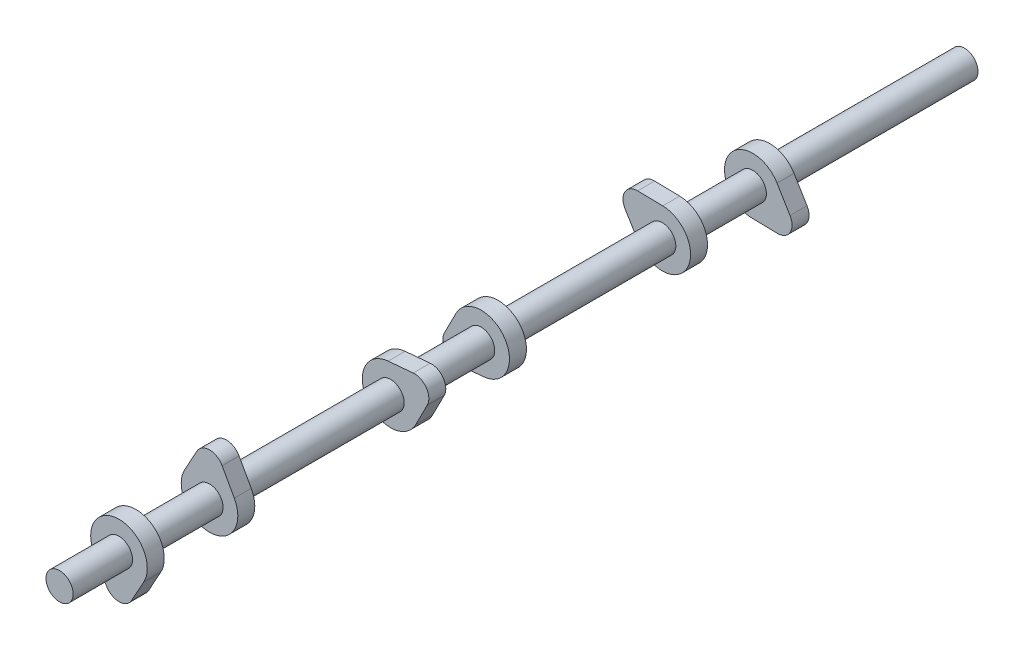
from build123d import *

# Parameters (mm, degrees)
SALIENTE_EXTRUIR1_DEPTH      = 3.75
S_LIDO_MOVER_COPIAR2_ANGLE   = 180
S_LIDO_MOVER_COPIAR4_START   = -243.75
S_LIDO_MOVER_COPIAR4_DEPTH   = 7.5
S_LIDO_MOVER_COPIAR4_START_2 = -203.75
S_LIDO_MOVER_COPIAR4_2_DEPTH = 7.5
S_LIDO_MOVER_COPIAR4_START_3 = -123.75
S_LIDO_MOVER_COPIAR4_3_DEPTH = 7.5
S_LIDO_MOVER_COPIAR4_START_4 = -83.75
S_LIDO_MOVER_COPIAR4_4_DEPTH = 7.5
S_LIDO_MOVER_COPIAR5_ANGLE   = 124
S_LIDO_MOVER_COPIAR6_ANGLE   = 120
CROQUIS5_R                   = 6
SALIENTE_EXTRUIR4_DEPTH      = 275
SALIENTE_EXTRUIR5_START      = 86
CROQUIS6_R                   = 6
SALIENTE_EXTRUIR5_DEPTH      = 86
CROQUIS7_R                   = 6
SALIENTE_EXTRUIR6_DEPTH      = 26.25


# Read off the part's stored shape, not the designer's step: Sólido-Mover/Copiar4
with BuildPart() as part:
    # Croquis1 → Saliente-Extruir1 (new, symmetric)
    with BuildSketch(Plane.XY):
        with BuildLine():
            Line((-5.555796523, 15.775), (-10.936607328, 6.053149606))
            ThreePointArc((-10.936607328, 6.053149606), (0, -12.5), (10.936607328, 6.053149606))
            Line((10.936607328, 6.053149606), (5.555796523, 15.775))
            ThreePointArc((5.555796523, 15.775), (0, 19.05), (-5.555796523, 15.775))
        make_face()
    extrude(amount=SALIENTE_EXTRUIR1_DEPTH, both=True)


with BuildPart() as body_2:
    # Sólido-Mover/Copiar1: copy of part
    add(part.part.moved(Location((0, 0, 40))))


with BuildPart() as body_2_1:
    # Sólido-Mover/Copiar2: moved
    add(body_2.part.rotate(Axis((0, 0, 0), (0, 0, 1)), S_LIDO_MOVER_COPIAR2_ANGLE))


with BuildPart() as body_3:
    # Sólido-Mover/Copiar4 outline → Sólido-Mover/Copiar4 (new body)
    with BuildSketch(Plane.XY.offset(S_LIDO_MOVER_COPIAR4_START)):
        with BuildLine():
            ThreePointArc((5.555796523, 15.775), (0, 19.05), (-5.555796523, 15.775))
            Line((-5.555796523, 15.775), (-10.936607328, 6.053149606))
            ThreePointArc((-10.936607328, 6.053149606), (-12.5, 0), (-10.936607328, -6.053149606))
            ThreePointArc((-10.936607328, -6.053149606), (0, -12.5), (10.936607328, -6.053149606))
            ThreePointArc((10.936607328, -6.053149606), (12.5, 0), (10.936607328, 6.053149606))
            Line((10.936607328, 6.053149606), (5.555796523, 15.775))
        make_face()
    extrude(amount=S_LIDO_MOVER_COPIAR4_DEPTH)


with BuildPart() as body_4:
    # S_lido-Mover_Copiar4 2 outline → S_lido-Mover_Copiar4 2 (new body)
    with BuildSketch(Plane.XY.offset(S_LIDO_MOVER_COPIAR4_START_2)):
        with BuildLine():
            Line((-10.936607328, -6.053149606), (-5.555796523, -15.775))
            ThreePointArc((-5.555796523, -15.775), (0, -19.05), (5.555796523, -15.775))
            Line((5.555796523, -15.775), (10.936607328, -6.053149606))
            ThreePointArc((10.936607328, -6.053149606), (0, 12.5), (-10.936607328, -6.053149606))
        make_face()
    extrude(amount=S_LIDO_MOVER_COPIAR4_2_DEPTH)


with BuildPart() as body_5:
    # S_lido-Mover_Copiar4 3 outline → S_lido-Mover_Copiar4 3 (new body)
    with BuildSketch(Plane.XY.offset(S_LIDO_MOVER_COPIAR4_START_3)):
        with BuildLine():
            ThreePointArc((5.555796523, 15.775), (0, 19.05), (-5.555796523, 15.775))
            Line((-5.555796523, 15.775), (-10.936607328, 6.053149606))
            ThreePointArc((-10.936607328, 6.053149606), (-12.5, 0), (-10.936607328, -6.053149606))
            ThreePointArc((-10.936607328, -6.053149606), (0, -12.5), (10.936607328, -6.053149606))
            ThreePointArc((10.936607328, -6.053149606), (12.5, 0), (10.936607328, 6.053149606))
            Line((10.936607328, 6.053149606), (5.555796523, 15.775))
        make_face()
    extrude(amount=S_LIDO_MOVER_COPIAR4_3_DEPTH)


with BuildPart() as body_6:
    # S_lido-Mover_Copiar4 4 outline → S_lido-Mover_Copiar4 4 (new body)
    with BuildSketch(Plane.XY.offset(S_LIDO_MOVER_COPIAR4_START_4)):
        with BuildLine():
            Line((-10.936607328, -6.053149606), (-5.555796523, -15.775))
            ThreePointArc((-5.555796523, -15.775), (0, -19.05), (5.555796523, -15.775))
            Line((5.555796523, -15.775), (10.936607328, -6.053149606))
            ThreePointArc((10.936607328, -6.053149606), (0, 12.5), (-10.936607328, -6.053149606))
        make_face()
    extrude(amount=S_LIDO_MOVER_COPIAR4_4_DEPTH)


with BuildPart() as body_6_1:
    # Sólido-Mover/Copiar5: moved
    add(body_6.part.rotate(Axis((0, 0, 0), (0, 0, 1)), S_LIDO_MOVER_COPIAR5_ANGLE))


with BuildPart() as body_5_1:
    # Sólido-Mover/Copiar5: moved
    add(body_5.part.rotate(Axis((0, 0, 0), (0, 0, 1)), S_LIDO_MOVER_COPIAR5_ANGLE))


with BuildPart() as body_3_1:
    # Sólido-Mover/Copiar6: moved
    add(body_3.part.rotate(Axis((0, 0, 0), (0, 0, -1)), S_LIDO_MOVER_COPIAR6_ANGLE))


with BuildPart() as body_4_1:
    # Sólido-Mover/Copiar6: moved
    add(body_4.part.rotate(Axis((0, 0, 0), (0, 0, -1)), S_LIDO_MOVER_COPIAR6_ANGLE))


with BuildPart() as part_1:
    add(part.part)

    add(body_2_1.part)  # Saliente-Extruir4 merges body 2

    add(body_3_1.part)  # Saliente-Extruir4 merges body 3

    add(body_4_1.part)  # Saliente-Extruir4 merges body 4

    add(body_5_1.part)  # Saliente-Extruir4 merges body 5

    add(body_6_1.part)  # Saliente-Extruir4 merges body 6
    # Croquis5 → Saliente-Extruir4 (add)
    with BuildSketch(Plane.XY.offset(-236.25)):
        Circle(CROQUIS5_R)
    extrude(amount=SALIENTE_EXTRUIR4_DEPTH)

    # Croquis6 → Saliente-Extruir5 (add)
    with BuildSketch(Plane(origin=(0, 0, -243.75), x_dir=(-1, 0, 0), z_dir=(0, 0, -1)).offset(SALIENTE_EXTRUIR5_START)):
        with Locations(Location((0, 0, 0), (0, 0, 180))):
            Circle(CROQUIS6_R)
    extrude(amount=-SALIENTE_EXTRUIR5_DEPTH)

    # Croquis7 → Saliente-Extruir6 (add)
    with BuildSketch(Plane.XY.offset(43.75)):
        Circle(CROQUIS7_R)
    extrude(amount=SALIENTE_EXTRUIR6_DEPTH)


solid = part_1.part
